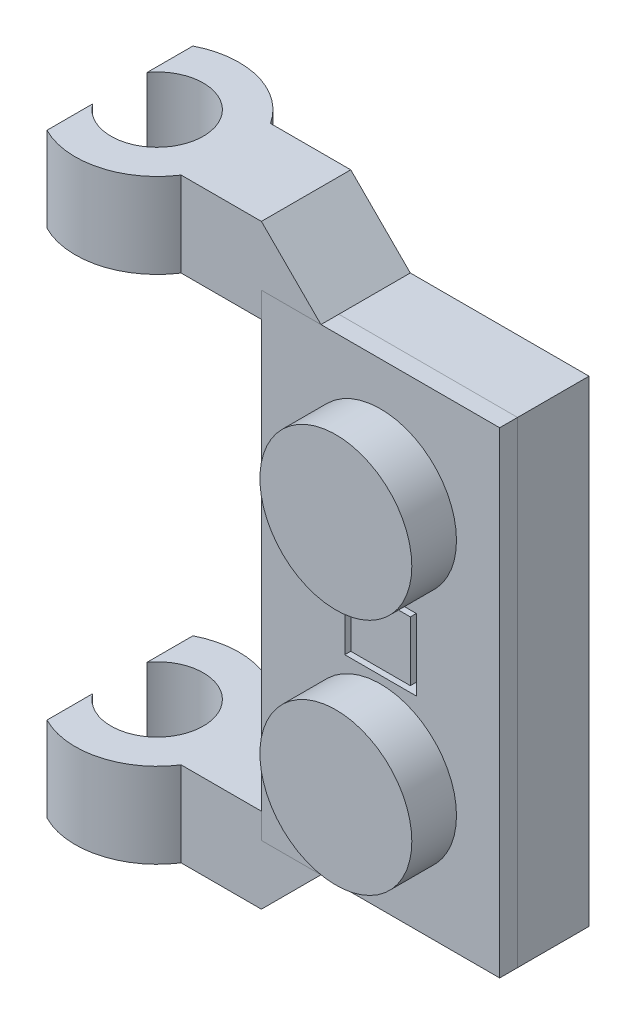
from build123d import *

# Parameters (mm, degrees)
BOSS_EXTRUDE1_DEPTH = 2.85
BOSS_EXTRUDE2_START = -10
SKETCH1_3_W         = 8
SKETCH1_3_H         = 3
BOSS_EXTRUDE2_DEPTH = 8
SKETCH2_R           = 2.55
BOSS_EXTRUDE3_DEPTH = 1.5
CUT_EXTRUDE1_START  = -3
SKETCH2_4_R         = 2.55
CUT_EXTRUDE1_DEPTH  = 1.8
SPLIT1_START        = -0.792385575
SPLIT1_OUTLINE_R    = 2.55
SPLIT1_DEPTH        = 2.1
SPLIT1_2_OUTLINE_W  = 8
SPLIT1_2_OUTLINE_H  = 16
SPLIT1_2_OUTLINE_R  = 2.55
SPLIT1_2_DEPTH      = 0.6
SPLIT1_START_2      = 14.088625645
SPLIT1_3_OUTLINE_W  = 16
SPLIT1_3_OUTLINE_H  = 2.1
SPLIT1_3_DEPTH      = 8
SKETCH3_W           = 2.4
SKETCH3_H           = 2.4
SKETCH3_W_2         = 2
SKETCH3_H_2         = 2
CUT_EXTRUDE2_DEPTH  = 65.924847621
BOSS_EXTRUDE4_REACH = 66.925
SKETCH3_3_W         = 2
SKETCH3_3_H         = 2
BOSS_EXTRUDE5_REACH = 66.925


# Read off the part's stored shape, not the designer's step: Split1
with BuildPart() as part:
    # Sketch1 → Boss-Extrude1 (new body)
    with BuildSketch(Plane.XZ.offset(60.903743363)):
        with BuildLine():
            ThreePointArc((11.39351176, -0.192385575), (9.798258558, 0.964477449), (7.838625645, 0.757104168))
            Line((7.838625645, 0.757104168), (7.838625645, -0.775870436))
            ThreePointArc((7.838625645, -0.775870436), (9.570808183, -0.219293589), (10.638625645, -1.692385575))
            ThreePointArc((10.638625645, -1.692385575), (9.570808183, -3.165477561), (7.838625645, -2.608900714))
            Line((7.838625645, -2.608900714), (7.838625645, -4.141875318))
            ThreePointArc((7.838625645, -4.141875318), (9.798258558, -4.349248599), (11.39351176, -3.192385575))
            ThreePointArc((11.39351176, -3.192385575), (11.724999748, -2.474710055), (11.838625645, -1.692385575))
            ThreePointArc((11.838625645, -1.692385575), (11.724999748, -0.910061094), (11.39351176, -0.192385575))
        make_face()
        with BuildLine():
            Line((14.088625645, -0.192385575), (11.39351176, -0.192385575))
            ThreePointArc((11.39351176, -0.192385575), (11.724999748, -0.910061094), (11.838625645, -1.692385575))
            ThreePointArc((11.838625645, -1.692385575), (11.724999748, -2.474710055), (11.39351176, -3.192385575))
            Line((11.39351176, -3.192385575), (14.088625645, -3.192385575))
            Line((14.088625645, -3.192385575), (14.088625645, -0.192385575))
        make_face()
    extrude(amount=-BOSS_EXTRUDE1_DEPTH)


with BuildPart() as body_2:
    # Mirror3: mirrored copy
    add(part.part.mirror(Plane(origin=(0, -50.903743363, 0), x_dir=(0, 0, 1), z_dir=(0, -1, 0))))


with BuildPart() as part_1:
    add(part.part)

    add(body_2.part)  # Boss-Extrude2 merges body 2
    # Sketch1<3> → Boss-Extrude2 (add, symmetric)
    with BuildSketch(Plane.XZ.offset(60.903743363).offset(BOSS_EXTRUDE2_START)):
        with Locations((18.088625645, -1.692385575)):
            Rectangle(SKETCH1_3_W, SKETCH1_3_H)
    extrude(amount=BOSS_EXTRUDE2_DEPTH, both=True)

    # Sketch2 → Boss-Extrude3 (add)
    with BuildSketch(Plane.XY.offset(-0.192385575)):
        with Locations((18.088625645, -54.903743363)):
            Circle(SKETCH2_R)
        with Locations((18.088625645, -46.903743363)):
            Circle(SKETCH2_R)
    extrude(amount=BOSS_EXTRUDE3_DEPTH)

    # Sketch2<4> → Cut-Extrude1 (cut)
    with BuildSketch(Plane.XY.offset(-0.192385575).offset(CUT_EXTRUDE1_START)):
        with Locations((18.088625645, -54.903743363)):
            Circle(SKETCH2_4_R)
        with Locations((18.088625645, -46.903743363)):
            Circle(SKETCH2_4_R)
    extrude(amount=CUT_EXTRUDE1_DEPTH, mode=Mode.SUBTRACT)

    # Split1 3 outline → Split1 3 (cut)
    with BuildSketch(Plane.YZ.offset(SPLIT1_START_2)):
        with Locations((-50.903743363, 0.257614425)):
            Rectangle(SPLIT1_3_OUTLINE_W, SPLIT1_3_OUTLINE_H)
    extrude(amount=SPLIT1_3_DEPTH, mode=Mode.SUBTRACT)

    # Sketch3<3> → Boss-Extrude4 (add, up to next)
    with BuildSketch(Plane.XY.offset(-0.192385575), mode=Mode.PRIVATE) as boss_extrude4_sk1:
        with Locations((18.088625645, -50.903743363)):
            Rectangle(SKETCH3_3_W, SKETCH3_3_H)
    boss_extrude4_tool1 = extrude(boss_extrude4_sk1.sketch, amount=-BOSS_EXTRUDE4_REACH, mode=Mode.PRIVATE) - part_1.part
    add(boss_extrude4_tool1.solids().sort_by_distance((18.088626, -50.903743, -0.192386))[0])

    # Boss-Extrude5: up to this face of the body (flat: up to its plane)
    boss_extrude5_end = Plane(part_1.part.faces().sort_by_distance((17.287207403, -50.903743363, -3.192385575))[0])
    # Sketch2<6> → Boss-Extrude5 (add, up to the picked face)
    with BuildSketch(Plane.XY.offset(-0.192385575), mode=Mode.PRIVATE) as boss_extrude5_sk1:
        Polygon((14.088625645, -58.903743363), (14.088625645, -60.903743363), (16.088625645, -58.903743363), align=None)
    boss_extrude5_tool1 = split(extrude(boss_extrude5_sk1.sketch, amount=-BOSS_EXTRUDE5_REACH, mode=Mode.PRIVATE), bisect_by=boss_extrude5_end, keep=Keep.BOTH, mode=Mode.PRIVATE)
    # Sketch2<6> → Boss-Extrude5 (add, up to the picked face)
    with BuildSketch(Plane.XY.offset(-0.192385575), mode=Mode.PRIVATE) as boss_extrude5_sk2:
        Polygon((16.088625645, -42.903743363), (14.088625645, -40.903743363), (14.088625645, -42.903743363), align=None)
    boss_extrude5_tool2 = split(extrude(boss_extrude5_sk2.sketch, amount=-BOSS_EXTRUDE5_REACH, mode=Mode.PRIVATE), bisect_by=boss_extrude5_end, keep=Keep.BOTH, mode=Mode.PRIVATE)
    add(boss_extrude5_tool1.solids().sort_by(Axis((14.755292, -59.57041, -0.192386), (0, 0, -1)))[0])
    add(boss_extrude5_tool2.solids().sort_by(Axis((14.755292, -42.237077, -0.192386), (0, 0, -1)))[0])


with BuildPart() as body_2_2:
    # Split1 outline → Split1 (new body)
    with BuildSketch(Plane.XY.offset(SPLIT1_START)):
        with Locations((18.088625645, -46.903743363)):
            Circle(SPLIT1_OUTLINE_R)
        with Locations((18.088625645, -54.903743363)):
            Circle(SPLIT1_OUTLINE_R)
    extrude(amount=SPLIT1_DEPTH)

    # Split1 2 outline → Split1 2 (add)
    with BuildSketch(Plane.XY.offset(SPLIT1_START)):
        with Locations((18.088625645, -50.903743363)):
            Rectangle(SPLIT1_2_OUTLINE_W, SPLIT1_2_OUTLINE_H)
        with Locations((18.088625645, -54.903743363)):
            Circle(SPLIT1_2_OUTLINE_R, mode=Mode.SUBTRACT)
        with Locations((18.088625645, -46.903743363)):
            Circle(SPLIT1_2_OUTLINE_R, mode=Mode.SUBTRACT)
    extrude(amount=SPLIT1_2_DEPTH)

    # Sketch3 → Cut-Extrude2 (cut, through all)
    with BuildSketch(Plane.XY.offset(-0.192385575)):
        with Locations((18.088625645, -50.903743363)):
            Rectangle(SKETCH3_W, SKETCH3_H)
        with Locations((18.088625645, -50.903743363)):
            Rectangle(SKETCH3_W_2, SKETCH3_H_2, mode=Mode.SUBTRACT)
    extrude(amount=-CUT_EXTRUDE2_DEPTH, mode=Mode.SUBTRACT)


with BuildPart() as cut_extrude2_kept_piece:
    # of the separate pieces the step leaves, the one the design keeps (cut_extrude2_pieces_kept)
    add(body_2_2.part.solids().sort_by_distance((20.638625645, -46.903743363, -0.192385575))[0])


solid = Compound([part_1.part, cut_extrude2_kept_piece.part])
